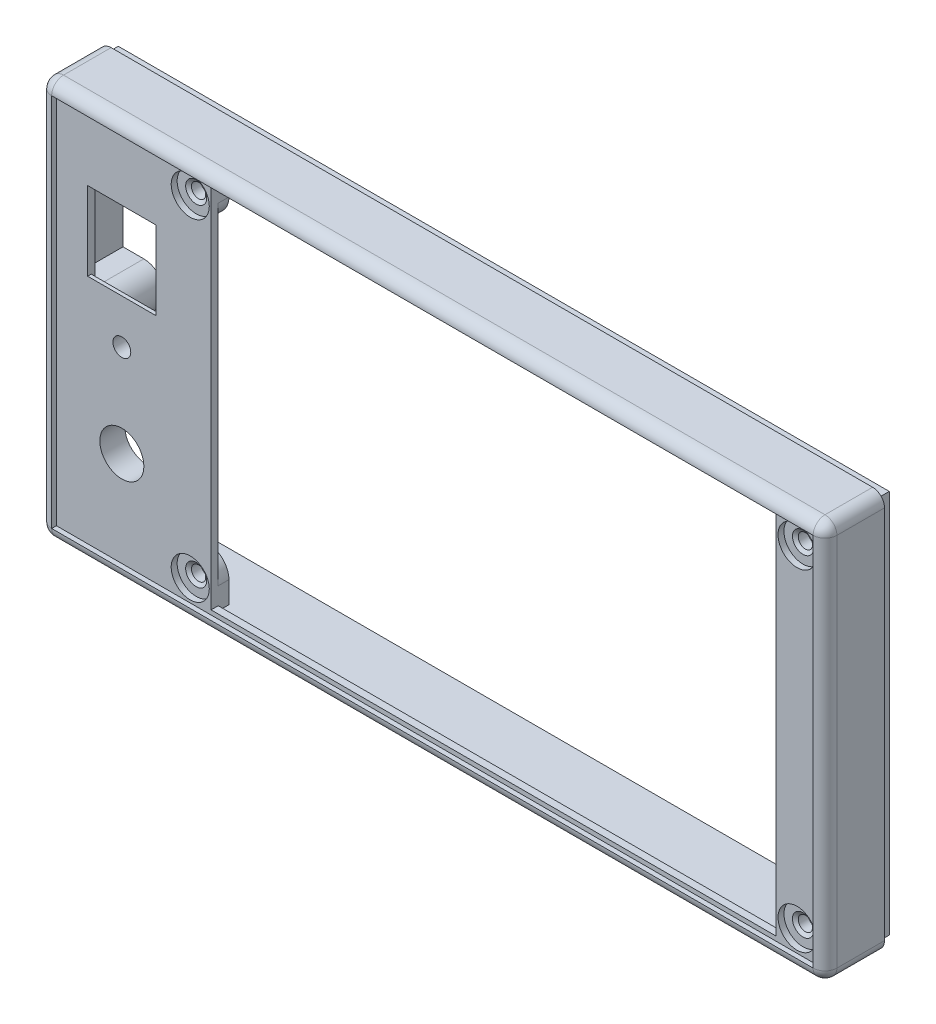
from build123d import *

# Parameters (mm, degrees)
SKETCH_1_W           = 132
SKETCH_1_H           = 67
EXTRUDE_1_DEPTH      = 10
SHELL_1_T            = -2
SKETCH_3_W           = 132
SKETCH_3_H           = 67
SKETCH_3_W_2         = 130.4
SKETCH_3_H_2         = 65.4
EXTRUDE_2_DEPTH      = 2
SKETCH_4_W           = 132
SKETCH_4_H           = 67
EXTRUDE_3_DEPTH      = 2
SKETCH_5_W           = 85
SKETCH_5_H           = 57
CUT_EXTRUDE_2_DEPTH  = 2
SKETCH_6_R           = 3.5
CUT_EXTRUDE_3_DEPTH  = 2
SKETCH_7_W           = 127
SKETCH_7_H           = 62
CUT_EXTRUDE_4_DEPTH  = 0.8
SKETCH_8_W           = 0.8
SKETCH_8_H           = 17.8
EXTRUDE_4_DEPTH      = 1.2
SKETCH_9_W           = 130.4
SKETCH_9_H           = 65.4
SKETCH_9_W_2         = 128
SKETCH_9_H_2         = 63
EXTRUDE_5_DEPTH      = 2
SKETCH_10_W          = 132
SKETCH_10_H          = 67
SKETCH_10_W_2        = 129.6
SKETCH_10_H_2        = 64.6
CUT_EXTRUDE_5_DEPTH  = 2
SKETCH_11_W          = 95
SKETCH_11_H          = 61.5
CUT_EXTRUDE_6_DEPTH  = 2
SKETCH_12_W          = 128
SKETCH_12_H          = 63
CUT_EXTRUDE_7_DEPTH  = 0.8
SKETCH_14_R          = 1.2
EXTRUDE_6_DEPTH      = 1.8
SKETCH_15_W          = 0.5
SKETCH_15_H          = 61.5
EXTRUDE_7_DEPTH      = 1.2
SKETCH_16_W          = 0.5
SKETCH_16_H          = 61.5
CUT_EXTRUDE_8_DEPTH  = 1.8
CUT_EXTRUDE_START    = -1.8
SKETCH_17_R          = 1.2
CUT_EXTRUDE_9_DEPTH  = 1.8
SKETCH_19_R          = 3.5
CUT_EXTRUDE_11_DEPTH = 1.8
SKETCH_22_R          = 3.5
EXTRUDE_9_DEPTH      = 1.2
SKETCH_23_R          = 1.5
SKETCH_23_W          = 11.5
SKETCH_23_H          = 15
CUT_EXTRUDE_13_DEPTH = 1.8
EXTRUDE_START        = 1
SKETCH_24_R          = 2.5
SKETCH_24_R_2        = 1.5
EXTRUDE_10_DEPTH     = 1
CHAMFER_1_SIZE       = 2
CHAMFER_1_SIZE2      = 1.400415076
SKETCH_25_R          = 1.2
EXTRUDE_11_DEPTH     = 10
SKETCH_26_W          = 1.2
SKETCH_26_H          = 15.6
CUT_EXTRUDE_14_DEPTH = 10
SKETCH_27_W          = 11.5
SKETCH_27_H          = 0.6
EXTRUDE_12_DEPTH     = 0.6
FILLET_1_R           = 2
SKETCH_28_R          = 3.7
CUT_EXTRUDE_15_DEPTH = 10
EXTRUDE_START_2      = 3
SKETCH_29_R          = 5.7
SKETCH_29_R_2        = 3.7
EXTRUDE_13_DEPTH     = 3
SKETCH_30_W          = 11.5
SKETCH_30_H          = 0.6
EXTRUDE_14_DEPTH     = 0.6
SKETCH_32_W          = 11.5
SKETCH_32_H          = 0.6
EXTRUDE_15_DEPTH     = 0.6
SKETCH_33_W          = 0.2
SKETCH_33_H          = 15.6
EXTRUDE_16_DEPTH     = 0.8
SKETCH_34_R          = 3.2
CUT_EXTRUDE_16_DEPTH = 1
SKETCH_35_R          = 3.2
CUT_EXTRUDE_17_DEPTH = 1


with BuildPart() as part:
    # Эскиз1 → Бобышка-Вытянуть1 (new body)
    with BuildSketch(Plane.XY):
        with Locations((30.55483871, -3.674193548)):
            Rectangle(SKETCH_1_W, SKETCH_1_H)
    extrude(amount=-EXTRUDE_1_DEPTH)

    # Оболочка1
    shell_1_openings = [part.faces().sort_by_distance(p)[0] for p in [
        (30.55483871, -3.674193548, -10),
        (30.55483871, -3.674193548, 0),
    ]]
    offset(amount=SHELL_1_T, openings=shell_1_openings, kind=Kind.INTERSECTION)

    # Эскиз3 → Бобышка-Вытянуть2 (add)
    with BuildSketch(Plane(origin=(0, 0, -10), x_dir=(-1, 0, 0), z_dir=(0, 0, -1))):
        with Locations((-30.55483871, -3.674193548)):
            Rectangle(SKETCH_3_W, SKETCH_3_H)
        with Locations((-30.55483871, -3.674193548)):
            Rectangle(SKETCH_3_W_2, SKETCH_3_H_2, mode=Mode.SUBTRACT)
    extrude(amount=EXTRUDE_2_DEPTH)

    # Эскиз4 → Бобышка-Вытянуть3 (add)
    with BuildSketch(Plane.XY):
        with Locations((30.55483871, -3.674193548)):
            Rectangle(SKETCH_4_W, SKETCH_4_H)
    extrude(amount=-EXTRUDE_3_DEPTH)

    # Эскиз5 → Вырез-Вытянуть2 (cut)
    with BuildSketch(Plane(origin=(0, 0, -2), x_dir=(-1, 0, 0), z_dir=(0, 0, -1))):
        with Locations((-43.05483871, -3.674193548)):
            Rectangle(SKETCH_5_W, SKETCH_5_H)
    extrude(amount=-CUT_EXTRUDE_2_DEPTH, mode=Mode.SUBTRACT)

    # Эскиз6 → Вырез-Вытянуть3 (cut)
    with BuildSketch(Plane(origin=(0, 0, -2), x_dir=(-1, 0, 0), z_dir=(0, 0, -1))):
        with Locations((21.94516129, -3.674193548)):
            Circle(SKETCH_6_R)
    extrude(amount=-CUT_EXTRUDE_3_DEPTH, mode=Mode.SUBTRACT)

    # Эскиз7 → Вырез-Вытянуть4 (cut)
    with BuildSketch(Plane.XY):
        with Locations((30.55483871, -3.674193548)):
            Rectangle(SKETCH_7_W, SKETCH_7_H)
    extrude(amount=-CUT_EXTRUDE_4_DEPTH, mode=Mode.SUBTRACT)

    # Эскиз8 → Бобышка-Вытянуть4 (add)
    with BuildSketch(Plane.ZY.offset(-95.75483871)):
        with Locations((-11.6, 14.525806452)):
            Rectangle(SKETCH_8_W, SKETCH_8_H)
        with Locations((-11.6, -21.874193548)):
            Rectangle(SKETCH_8_W, SKETCH_8_H)
    extrude(amount=EXTRUDE_4_DEPTH)

    # Эскиз9 → Бобышка-Вытянуть5 (add)
    with BuildSketch(Plane(origin=(0, 0, -12), x_dir=(-1, 0, 0), z_dir=(0, 0, -1))):
        with Locations((-30.55483871, -3.674193548)):
            Rectangle(SKETCH_9_W, SKETCH_9_H)
        with Locations((-30.55483871, -3.674193548)):
            Rectangle(SKETCH_9_W_2, SKETCH_9_H_2, mode=Mode.SUBTRACT)
    extrude(amount=-EXTRUDE_5_DEPTH)

    # Эскиз10 → Вырез-Вытянуть5 (cut)
    with BuildSketch(Plane(origin=(0, 0, -12), x_dir=(-1, 0, 0), z_dir=(0, 0, -1))):
        with Locations((-30.55483871, -3.674193548)):
            Rectangle(SKETCH_10_W, SKETCH_10_H)
        with Locations((-30.55483871, -3.674193548)):
            Rectangle(SKETCH_10_W_2, SKETCH_10_H_2, mode=Mode.SUBTRACT)
    extrude(amount=-CUT_EXTRUDE_5_DEPTH, mode=Mode.SUBTRACT)

    # Эскиз11 → Вырез-Вытянуть6 (cut)
    with BuildSketch(Plane(origin=(0, 0, -2), x_dir=(-1, 0, 0), z_dir=(0, 0, -1))):
        with Locations((-39.55483871, -3.674193548)):
            Rectangle(SKETCH_11_W, SKETCH_11_H)
    extrude(amount=-CUT_EXTRUDE_6_DEPTH, mode=Mode.SUBTRACT)

    # Эскиз12 → Вырез-Вытянуть7 (cut)
    with BuildSketch(Plane.XY):
        with Locations((30.55483871, -3.674193548)):
            Rectangle(SKETCH_12_W, SKETCH_12_H)
    extrude(amount=-CUT_EXTRUDE_7_DEPTH, mode=Mode.SUBTRACT)

    # Эскиз14 → Бобышка-Вытянуть6 (add)
    # profile 1 of 4: a face of its own
    with BuildSketch(Plane(origin=(0, 0, -2), x_dir=(-1, 0, 0), z_dir=(0, 0, -1))):
        with BuildLine():
            Line((-94.55483871, -28.024193548), (-94.55483871, -35.174193548))
            Line((-94.55483871, -35.174193548), (-87.55483871, -35.174193548))
            Line((-87.55483871, -35.174193548), (-87.55483871, -31.524193548))
            ThreePointArc((-87.55483871, -31.524193548), (-88.579964976, -29.049319814), (-91.05483871, -28.024193548))
            Line((-91.05483871, -28.024193548), (-94.55483871, -28.024193548))
        make_face()
        with Locations((-91.05483871, -31.524193548)):
            Circle(SKETCH_14_R, mode=Mode.SUBTRACT)
    # profile 2 of 4: a face of its own
    with BuildSketch(Plane(origin=(0, 0, -2), x_dir=(-1, 0, 0), z_dir=(0, 0, -1))):
        with BuildLine():
            Line((-87.55483871, 24.175806452), (-87.55483871, 27.825806452))
            Line((-87.55483871, 27.825806452), (-94.55483871, 27.825806452))
            Line((-94.55483871, 27.825806452), (-94.55483871, 20.675806452))
            Line((-94.55483871, 20.675806452), (-91.05483871, 20.675806452))
            ThreePointArc((-91.05483871, 20.675806452), (-88.579964976, 21.700932717), (-87.55483871, 24.175806452))
        make_face()
        with Locations((-91.05483871, 24.175806452)):
            Circle(SKETCH_14_R, mode=Mode.SUBTRACT)
    # profile 3 of 4: a face of its own
    with BuildSketch(Plane(origin=(0, 0, -2), x_dir=(-1, 0, 0), z_dir=(0, 0, -1))):
        with BuildLine():
            Line((7.44516129, 24.175806452), (7.44516129, 27.825806452))
            Line((7.44516129, 27.825806452), (14.44516129, 27.825806452))
            Line((14.44516129, 27.825806452), (14.44516129, 24.175806452))
            ThreePointArc((14.44516129, 24.175806452), (10.94516129, 20.675806452), (7.44516129, 24.175806452))
        make_face()
        with Locations((10.94516129, 24.175806452)):
            Circle(SKETCH_14_R, mode=Mode.SUBTRACT)
    # profile 4 of 4: a face of its own
    with BuildSketch(Plane(origin=(0, 0, -2), x_dir=(-1, 0, 0), z_dir=(0, 0, -1))):
        with BuildLine():
            Line((7.44516129, -31.524193548), (7.44516129, -35.174193548))
            Line((7.44516129, -35.174193548), (14.44516129, -35.174193548))
            Line((14.44516129, -35.174193548), (14.44516129, -31.524193548))
            ThreePointArc((14.44516129, -31.524193548), (10.94516129, -28.024193548), (7.44516129, -31.524193548))
        make_face()
        with Locations((10.94516129, -31.524193548)):
            Circle(SKETCH_14_R, mode=Mode.SUBTRACT)
    extrude(amount=EXTRUDE_6_DEPTH)

    # Эскиз15 → Бобышка-Вытянуть7 (add)
    with BuildSketch(Plane.XY.offset(-0.8)):
        with Locations((-7.69516129, -3.674193548)):
            Rectangle(SKETCH_15_W, SKETCH_15_H)
    extrude(amount=-EXTRUDE_7_DEPTH)

    # Эскиз16 → Вырез-Вытянуть8 (cut)
    with BuildSketch(Plane(origin=(0, 0, -2), x_dir=(-1, 0, 0), z_dir=(0, 0, -1))):
        with Locations((-87.30483871, -3.674193548)):
            Rectangle(SKETCH_16_W, SKETCH_16_H)
    extrude(amount=-CUT_EXTRUDE_8_DEPTH, mode=Mode.SUBTRACT)

    # Эскиз17 → Вырез-Вытянуть9 (cut)
    with BuildSketch(Plane(origin=(0, 0, -2), x_dir=(-1, 0, 0), z_dir=(0, 0, -1)).offset(CUT_EXTRUDE_START)):
        with Locations(Location((-91.05483871, 24.175806452, 0), (0, 0, 180))):
            Circle(SKETCH_17_R)
        with Locations(Location((-91.05483871, -31.524193548, 0), (0, 0, 180))):
            Circle(SKETCH_17_R)
        with Locations(Location((10.94516129, -31.524193548, 0), (0, 0, 180))):
            Circle(SKETCH_17_R)
        with Locations(Location((10.94516129, 24.175806452, 0), (0, 0, 180))):
            Circle(SKETCH_17_R)
    extrude(amount=CUT_EXTRUDE_9_DEPTH, mode=Mode.SUBTRACT)

    # Эскиз19 → Вырез-Вытянуть11 (cut)
    with BuildSketch(Plane(origin=(0, 0, -2), x_dir=(-1, 0, 0), z_dir=(0, 0, -1))):
        with Locations((22.44516129, -19.174193548)):
            Circle(SKETCH_19_R)
    extrude(amount=-CUT_EXTRUDE_11_DEPTH, mode=Mode.SUBTRACT)

    # Эскиз22 → Бобышка-Вытянуть9 (add)
    with BuildSketch(Plane(origin=(0, 0, -2), x_dir=(-1, 0, 0), z_dir=(0, 0, -1))):
        with Locations((21.94516129, -3.674193548)):
            Circle(SKETCH_22_R)
    extrude(amount=-EXTRUDE_9_DEPTH)

    # Эскиз23 → Вырез-Вытянуть13 (cut)
    with BuildSketch(Plane(origin=(0, 0, -2), x_dir=(-1, 0, 0), z_dir=(0, 0, -1))):
        with Locations((22.44516129, -3.674193548)):
            Circle(SKETCH_23_R)
        with Locations((22.44516129, 10.075806452)):
            Rectangle(SKETCH_23_W, SKETCH_23_H)
    extrude(amount=-CUT_EXTRUDE_13_DEPTH, mode=Mode.SUBTRACT)

    # Эскиз24 → Бобышка-Вытянуть10 (add)
    with BuildSketch(Plane(origin=(0, 0, -2), x_dir=(-1, 0, 0), z_dir=(0, 0, -1)).offset(EXTRUDE_START)):
        with Locations(Location((22.44516129, -3.674193548, 0), (0, 0, 180))):
            Circle(SKETCH_24_R)
        with Locations((22.44516129, -3.674193548)):
            Circle(SKETCH_24_R_2, mode=Mode.SUBTRACT)
    extrude(amount=-EXTRUDE_10_DEPTH)

    # Фаска1
    chamfer_1_edges = [part.edges().sort_by_distance(p)[0] for p in [
        (-12.14516129, 24.175806452, -0.8),
        (-12.14516129, -31.524193548, -0.8),
        (89.85483871, -31.524193548, -0.8),
        (89.85483871, 24.175806452, -0.8),
    ]]
    chamfer_1_side = [part.faces().sort_by_distance(p)[0] for p in [
        (30.55483871, 27.683142511, -0.8),
    ]]
    chamfer(chamfer_1_edges, length=CHAMFER_1_SIZE, length2=CHAMFER_1_SIZE2, reference=chamfer_1_side[0])

    # Эскиз25 → Бобышка-Вытянуть11 (add)
    with BuildSketch(Plane(origin=(0, 0, -2), x_dir=(-1, 0, 0), z_dir=(0, 0, -1))):
        with BuildLine():
            Line((29.94516129, -0.174193548), (33.44516129, -0.174193548))
            Line((33.44516129, -0.174193548), (33.44516129, -7.174193548))
            Line((33.44516129, -7.174193548), (29.94516129, -7.174193548))
            ThreePointArc((29.94516129, -7.174193548), (26.44516129, -3.674193548), (29.94516129, -0.174193548))
        make_face()
        with Locations((29.94516129, -3.674193548)):
            Circle(SKETCH_25_R, mode=Mode.SUBTRACT)
    extrude(amount=EXTRUDE_11_DEPTH)

    # Эскиз26 → Вырез-Вытянуть14 (cut)
    with BuildSketch(Plane(origin=(95.35483871, 0, 0), x_dir=(0, 0, -1), z_dir=(1, 0, 0))):
        with Locations((10.6, 11.025806452)):
            Rectangle(SKETCH_26_W, SKETCH_26_H)
        with Locations((10.6, -18.374193548)):
            Rectangle(SKETCH_26_W, SKETCH_26_H)
    extrude(amount=-CUT_EXTRUDE_14_DEPTH, mode=Mode.SUBTRACT)

    # Эскиз27 → Бобышка-Вытянуть12 (add)
    with BuildSketch(Plane.XY.offset(-0.8)):
        with Locations((-22.44516129, 17.275806452)):
            Rectangle(SKETCH_27_W, SKETCH_27_H)
        with Locations((-22.44516129, 2.875806452)):
            Rectangle(SKETCH_27_W, SKETCH_27_H)
    extrude(amount=-EXTRUDE_12_DEPTH)

    # Скругление1
    fillet_1_edges = [part.edges().sort_by_distance(p)[0] for p in [
        (-35.44516129, -37.174193548, -5),
        (96.55483871, -37.174193548, -5),
        (96.55483871, 29.825806452, -5),
        (-35.44516129, 29.825806452, -5),
        (30.55483871, 29.825806452, 0),
        (96.55483871, -3.674193548, 0),
        (30.55483871, -37.174193548, 0),
        (-35.44516129, -3.674193548, 0),
    ]]
    fillet(fillet_1_edges, radius=FILLET_1_R - 0.0001)  # a hair under: the kernel refuses the full size

    # Эскиз28 → Вырез-Вытянуть15 (cut)
    with BuildSketch(Plane(origin=(0, 0, -2), x_dir=(-1, 0, 0), z_dir=(0, 0, -1))):
        with Locations((22.44516129, -19.174193548)):
            Circle(SKETCH_28_R)
    extrude(amount=-CUT_EXTRUDE_15_DEPTH, mode=Mode.SUBTRACT)

    # Эскиз29 → Бобышка-Вытянуть13 (add)
    with BuildSketch(Plane(origin=(0, 0, -2), x_dir=(-1, 0, 0), z_dir=(0, 0, -1)).offset(EXTRUDE_START_2)):
        with Locations(Location((22.44516129, -19.174193548, 0), (0, 0, 180))):
            Circle(SKETCH_29_R)
        with Locations((22.44516129, -19.174193548)):
            Circle(SKETCH_29_R_2, mode=Mode.SUBTRACT)
    extrude(amount=-EXTRUDE_13_DEPTH)

    # Эскиз30 → Бобышка-Вытянуть14 (add)
    with BuildSketch(Plane(origin=(0, 0, -1.4), x_dir=(-1, 0, 0), z_dir=(0, 0, -1))):
        with Locations((22.44516129, 2.875806452)):
            Rectangle(SKETCH_30_W, SKETCH_30_H)
    extrude(amount=EXTRUDE_14_DEPTH)

    # Эскиз32 → Бобышка-Вытянуть15 (add)
    with BuildSketch(Plane.XY.offset(-0.8)):
        with Locations((-22.44516129, 3.475806452)):
            Rectangle(SKETCH_32_W, SKETCH_32_H)
    extrude(amount=-EXTRUDE_15_DEPTH)

    # Эскиз33 → Бобышка-Вытянуть16 (add)
    with BuildSketch(Plane.ZY.offset(-94.55483871)):
        with Locations((-11.1, 11.025806452)):
            Rectangle(SKETCH_33_W, SKETCH_33_H)
        with Locations((-11.1, -18.374193548)):
            Rectangle(SKETCH_33_W, SKETCH_33_H)
    extrude(amount=-EXTRUDE_16_DEPTH)

    # Эскиз34 → Вырез-Вытянуть16 (cut)
    with BuildSketch(Plane.XY.offset(-0.8)):
        with Locations((-10.94516129, 24.175806452)):
            Circle(SKETCH_34_R)
    extrude(amount=-CUT_EXTRUDE_16_DEPTH, mode=Mode.SUBTRACT)

    # Эскиз35 → Вырез-Вытянуть17 (cut)
    with BuildSketch(Plane.XY.offset(-0.8)):
        with Locations((-10.94516129, -31.524193548)):
            Circle(SKETCH_35_R)
        with Locations((91.05483871, -31.524193548)):
            Circle(SKETCH_35_R)
        with Locations((91.05483871, 24.175806452)):
            Circle(SKETCH_35_R)
    extrude(amount=-CUT_EXTRUDE_17_DEPTH, mode=Mode.SUBTRACT)


solid = part.part
